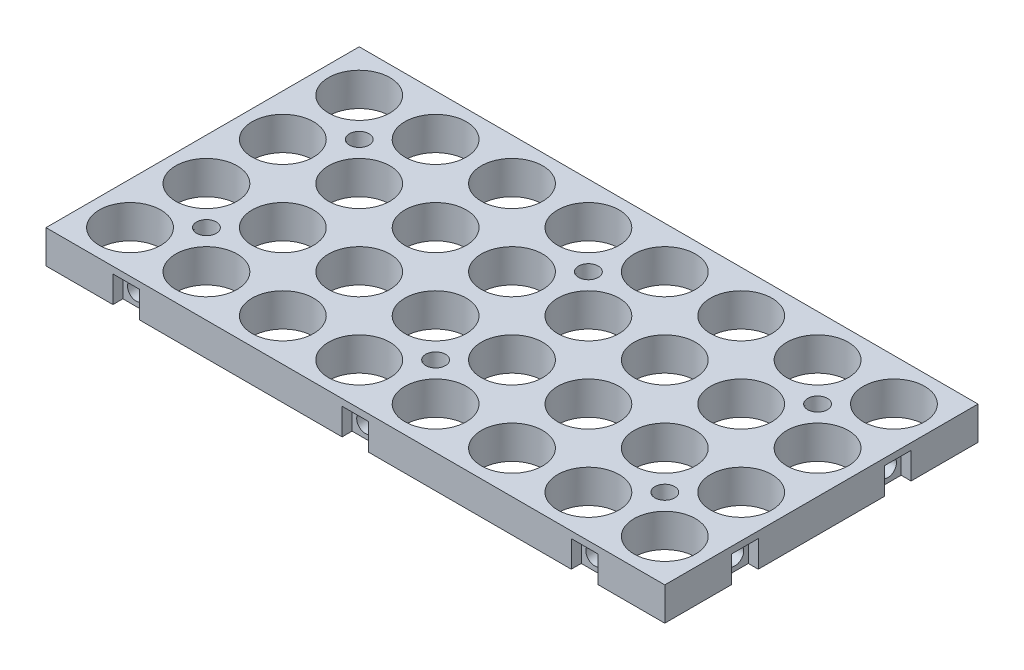
from build123d import *

# Parameters (mm, degrees)
SKETCH1_W                 = 255.3
SKETCH1_H                 = 94.3
BOSS_EXTRUDE1_DEPTH       = 10
SKETCH2_R                 = 9.25
CUT_EXTRUDE1_DEPTH        = 22.3
LPATTERN1_COUNT           = 4
LPATTERN1_PITCH           = 23
LPATTERN1_COUNT_DIR2      = 8
LPATTERN1_PITCH_DIR2      = 23
ADVANCEDHOLE1_OUTLINE_R   = 2.640000288
ADVANCEDHOLE1_DEPTH       = 7.996
ADVANCEDHOLE1_DRAFT       = -2.36329
ADVANCEDHOLE1_2_OUTLINE_R = 2.640000288
ADVANCEDHOLE1_2_DEPTH     = 7.996
ADVANCEDHOLE1_2_DRAFT     = -2.36329
ADVANCEDHOLE1_3_OUTLINE_R = 2.640000288
ADVANCEDHOLE1_3_DEPTH     = 7.996
ADVANCEDHOLE1_3_DRAFT     = -2.36329
ADVANCEDHOLE1_4_OUTLINE_R = 2.640000288
ADVANCEDHOLE1_4_DEPTH     = 7.996
ADVANCEDHOLE1_4_DRAFT     = -2.36329
MIRROR1_COPY_1_SKETCH_R   = 2.640000288
MIRROR1_COPY_1_DEPTH      = 7.996
MIRROR1_COPY_1_DRAFT      = -2.36329
MIRROR1_COPY_2_SKETCH_R   = 2.640000288
MIRROR1_COPY_2_DEPTH      = 7.996
MIRROR1_COPY_2_DRAFT      = -2.36329
MIRROR1_COPY_3_SKETCH_R   = 2.640000288
MIRROR1_COPY_3_DEPTH      = 7.996
MIRROR1_COPY_3_DRAFT      = -2.36329
MIRROR1_COPY_4_SKETCH_R   = 2.640000288
MIRROR1_COPY_4_DEPTH      = 7.996
MIRROR1_COPY_4_DRAFT      = -2.36329
MIRROR1_COPY_5_SKETCH_R   = 2.640000288
MIRROR1_COPY_5_DEPTH      = 7.996
MIRROR1_COPY_5_DRAFT      = -2.36329
MIRROR1_COPY_6_SKETCH_R   = 2.640000288
MIRROR1_COPY_6_DEPTH      = 7.996
MIRROR1_COPY_6_DRAFT      = -2.36329
MIRROR1_COPY_7_SKETCH_R   = 2.640000288
MIRROR1_COPY_7_DEPTH      = 7.996
MIRROR1_COPY_7_DRAFT      = -2.36329
SKETCH6_W                 = 69
SKETCH6_H                 = 94.3
CUT_EXTRUDE2_DEPTH        = 273.342761975
SKETCH8_W                 = 8
SKETCH8_H                 = 8
CUT_EXTRUDE3_DEPTH        = 3
LPATTERN2_COUNT           = 3
LPATTERN2_PITCH           = 69
MIRROR2_COPY_1_SKETCH_W   = 8
MIRROR2_COPY_1_SKETCH_H   = 8
MIRROR2_COPY_1_DEPTH      = 3
MIRROR2_COPY_2_SKETCH_W   = 8
MIRROR2_COPY_2_SKETCH_H   = 8
MIRROR2_COPY_2_DEPTH      = 3
SKETCH9_W                 = 8
SKETCH9_H                 = 8
CUT_EXTRUDE4_DEPTH        = 3
LPATTERN3_COUNT           = 2
LPATTERN3_PITCH           = 46
MIRROR3_COPY_1_SKETCH_W   = 8
MIRROR3_COPY_1_SKETCH_H   = 8
MIRROR3_COPY_1_DEPTH      = 3


# Read off the part's stored shape, not the designer's step: AdvancedHole1, AdvancedHole2, AdvancedHole3
with BuildPart() as part:
    # Sketch1 → Boss-Extrude1 (new body)
    with BuildSketch(Plane(origin=(0, 0, 0), x_dir=(1, 0, 0), z_dir=(0, 1, 0))):
        with Locations((127.65, 47.15)):
            Rectangle(SKETCH1_W, SKETCH1_H)
    extrude(amount=BOSS_EXTRUDE1_DEPTH)

    # Sketch2 → Cut-Extrude1 (cut)
    with BuildSketch(Plane(origin=(0, 10, 0), x_dir=(1, 0, 0), z_dir=(0, 1, 0))):
        with Locations(Location((12.65, 12.65, 0), (0, 0, 270))):
            Circle(SKETCH2_R)
    cut_extrude1 = extrude(amount=-CUT_EXTRUDE1_DEPTH, mode=Mode.SUBTRACT)

    # LPattern1: Cut-Extrude1 4 × 8
    with Locations(*[(j * LPATTERN1_PITCH_DIR2, 0, -i * LPATTERN1_PITCH) for i in range(LPATTERN1_COUNT) for j in range(LPATTERN1_COUNT_DIR2) if (i, j) != (0, 0)]):
        add(cut_extrude1, mode=Mode.SUBTRACT)


with BuildPart() as advancedhole1_tool:
    # AdvancedHole1 outline → AdvancedHole1 (with draft: the straight prism first)
    with BuildSketch(Plane(origin=(0, 2.004, 0), x_dir=(1, 0, 0), z_dir=(0, 1, 0))):
        with Locations((162.15, 70.15)):
            Circle(ADVANCEDHOLE1_OUTLINE_R)
    extrude(amount=ADVANCEDHOLE1_DEPTH)
    # AdvancedHole1: the draft: its side faces are tilted about the plane it starts from
    advancedhole1_sides = [advancedhole1_tool.faces().sort_by_distance(p)[0] for p in [
        (159.509999712, 6.002, -70.15),
    ]]
    draft(advancedhole1_sides, Plane(origin=(0, 2.004, 0), x_dir=(1, 0, 0), z_dir=(0, 1, 0)), ADVANCEDHOLE1_DRAFT)


with BuildPart() as part_1:
    add(part.part)

    # AdvancedHole1: cut by advancedhole1_tool
    add(advancedhole1_tool.part, mode=Mode.SUBTRACT)


with BuildPart() as advancedhole1_2_tool:
    # AdvancedHole1 2 outline → AdvancedHole1 2 (with draft: the straight prism first)
    with BuildSketch(Plane(origin=(0, 2.004, 0), x_dir=(1, 0, 0), z_dir=(0, 1, 0))):
        with Locations((93.15, 70.15)):
            Circle(ADVANCEDHOLE1_2_OUTLINE_R)
    extrude(amount=ADVANCEDHOLE1_2_DEPTH)
    # AdvancedHole1 2: the draft: its side faces are tilted about the plane it starts from
    advancedhole1_2_sides = [advancedhole1_2_tool.faces().sort_by_distance(p)[0] for p in [
        (90.509999712, 6.002, -70.15),
    ]]
    draft(advancedhole1_2_sides, Plane(origin=(0, 2.004, 0), x_dir=(1, 0, 0), z_dir=(0, 1, 0)), ADVANCEDHOLE1_2_DRAFT)


with BuildPart() as part_2:
    add(part_1.part)

    # AdvancedHole1 2: cut by advancedhole1_2_tool
    add(advancedhole1_2_tool.part, mode=Mode.SUBTRACT)


with BuildPart() as advancedhole1_3_tool:
    # AdvancedHole1 3 outline → AdvancedHole1 3 (with draft: the straight prism first)
    with BuildSketch(Plane(origin=(0, 2.004, 0), x_dir=(1, 0, 0), z_dir=(0, 1, 0))):
        with Locations((24.15, 70.15)):
            Circle(ADVANCEDHOLE1_3_OUTLINE_R)
    extrude(amount=ADVANCEDHOLE1_3_DEPTH)
    # AdvancedHole1 3: the draft: its side faces are tilted about the plane it starts from
    advancedhole1_3_sides = [advancedhole1_3_tool.faces().sort_by_distance(p)[0] for p in [
        (21.509999712, 6.002, -70.15),
    ]]
    draft(advancedhole1_3_sides, Plane(origin=(0, 2.004, 0), x_dir=(1, 0, 0), z_dir=(0, 1, 0)), ADVANCEDHOLE1_3_DRAFT)


with BuildPart() as part_3:
    add(part_2.part)

    # AdvancedHole1 3: cut by advancedhole1_3_tool
    add(advancedhole1_3_tool.part, mode=Mode.SUBTRACT)


with BuildPart() as advancedhole1_4_tool:
    # AdvancedHole1 4 outline → AdvancedHole1 4 (with draft: the straight prism first)
    with BuildSketch(Plane(origin=(0, 2.004, 0), x_dir=(1, 0, 0), z_dir=(0, 1, 0))):
        with Locations((231.15, 70.15)):
            Circle(ADVANCEDHOLE1_4_OUTLINE_R)
    extrude(amount=ADVANCEDHOLE1_4_DEPTH)
    # AdvancedHole1 4: the draft: its side faces are tilted about the plane it starts from
    advancedhole1_4_sides = [advancedhole1_4_tool.faces().sort_by_distance(p)[0] for p in [
        (228.509999712, 6.002, -70.15),
    ]]
    draft(advancedhole1_4_sides, Plane(origin=(0, 2.004, 0), x_dir=(1, 0, 0), z_dir=(0, 1, 0)), ADVANCEDHOLE1_4_DRAFT)


with BuildPart() as part_4:
    add(part_3.part)

    # AdvancedHole1 4: cut by advancedhole1_4_tool
    add(advancedhole1_4_tool.part, mode=Mode.SUBTRACT)


with BuildPart() as mirror1_copy_1_tool:
    # Mirror1 copy 1 sketch → Mirror1 copy 1 (with draft: the straight prism first)
    with BuildSketch(Plane(origin=(0, 2.004, -94.3), x_dir=(1, 0, 0), z_dir=(0, 1, 0))):
        with Locations((162.15, -70.15)):
            Circle(MIRROR1_COPY_1_SKETCH_R)
    extrude(amount=MIRROR1_COPY_1_DEPTH)
    # Mirror1 copy 1: the draft: its side faces are tilted about the plane it starts from
    mirror1_copy_1_sides = [mirror1_copy_1_tool.faces().sort_by_distance(p)[0] for p in [
        (159.509999712, 6.002, -24.15),
    ]]
    draft(mirror1_copy_1_sides, Plane(origin=(0, 2.004, -94.3), x_dir=(1, 0, 0), z_dir=(0, 1, 0)), MIRROR1_COPY_1_DRAFT)


with BuildPart() as part_5:
    add(part_4.part)

    # Mirror1 copy 1: cut by mirror1_copy_1_tool
    add(mirror1_copy_1_tool.part, mode=Mode.SUBTRACT)


with BuildPart() as mirror1_copy_2_tool:
    # Mirror1 copy 2 sketch → Mirror1 copy 2 (with draft: the straight prism first)
    with BuildSketch(Plane(origin=(0, 2.004, -94.3), x_dir=(1, 0, 0), z_dir=(0, 1, 0))):
        with Locations((93.15, -70.15)):
            Circle(MIRROR1_COPY_2_SKETCH_R)
    extrude(amount=MIRROR1_COPY_2_DEPTH)
    # Mirror1 copy 2: the draft: its side faces are tilted about the plane it starts from
    mirror1_copy_2_sides = [mirror1_copy_2_tool.faces().sort_by_distance(p)[0] for p in [
        (90.509999712, 6.002, -24.15),
    ]]
    draft(mirror1_copy_2_sides, Plane(origin=(0, 2.004, -94.3), x_dir=(1, 0, 0), z_dir=(0, 1, 0)), MIRROR1_COPY_2_DRAFT)


with BuildPart() as part_6:
    add(part_5.part)

    # Mirror1 copy 2: cut by mirror1_copy_2_tool
    add(mirror1_copy_2_tool.part, mode=Mode.SUBTRACT)


with BuildPart() as mirror1_copy_3_tool:
    # Mirror1 copy 3 sketch → Mirror1 copy 3 (with draft: the straight prism first)
    with BuildSketch(Plane(origin=(0, 2.004, -94.3), x_dir=(1, 0, 0), z_dir=(0, 1, 0))):
        with Locations((24.15, -70.15)):
            Circle(MIRROR1_COPY_3_SKETCH_R)
    extrude(amount=MIRROR1_COPY_3_DEPTH)
    # Mirror1 copy 3: the draft: its side faces are tilted about the plane it starts from
    mirror1_copy_3_sides = [mirror1_copy_3_tool.faces().sort_by_distance(p)[0] for p in [
        (21.509999712, 6.002, -24.15),
    ]]
    draft(mirror1_copy_3_sides, Plane(origin=(0, 2.004, -94.3), x_dir=(1, 0, 0), z_dir=(0, 1, 0)), MIRROR1_COPY_3_DRAFT)


with BuildPart() as part_7:
    add(part_6.part)

    # Mirror1 copy 3: cut by mirror1_copy_3_tool
    add(mirror1_copy_3_tool.part, mode=Mode.SUBTRACT)


with BuildPart() as mirror1_copy_4_tool:
    # Mirror1 copy 4 sketch → Mirror1 copy 4 (with draft: the straight prism first)
    with BuildSketch(Plane(origin=(0, 2.004, -94.3), x_dir=(1, 0, 0), z_dir=(0, 1, 0))):
        with Locations((231.15, -70.15)):
            Circle(MIRROR1_COPY_4_SKETCH_R)
    extrude(amount=MIRROR1_COPY_4_DEPTH)
    # Mirror1 copy 4: the draft: its side faces are tilted about the plane it starts from
    mirror1_copy_4_sides = [mirror1_copy_4_tool.faces().sort_by_distance(p)[0] for p in [
        (228.509999712, 6.002, -24.15),
    ]]
    draft(mirror1_copy_4_sides, Plane(origin=(0, 2.004, -94.3), x_dir=(1, 0, 0), z_dir=(0, 1, 0)), MIRROR1_COPY_4_DRAFT)


with BuildPart() as part_8:
    add(part_7.part)

    # Mirror1 copy 4: cut by mirror1_copy_4_tool
    add(mirror1_copy_4_tool.part, mode=Mode.SUBTRACT)


with BuildPart() as mirror1_copy_5_tool:
    # Mirror1 copy 5 sketch → Mirror1 copy 5 (with draft: the straight prism first)
    with BuildSketch(Plane(origin=(0, 2.004, -94.3), x_dir=(1, 0, 0), z_dir=(0, 1, 0))):
        with Locations((93.15, -70.15)):
            Circle(MIRROR1_COPY_5_SKETCH_R)
    extrude(amount=MIRROR1_COPY_5_DEPTH)
    # Mirror1 copy 5: the draft: its side faces are tilted about the plane it starts from
    mirror1_copy_5_sides = [mirror1_copy_5_tool.faces().sort_by_distance(p)[0] for p in [
        (90.509999712, 6.002, -24.15),
    ]]
    draft(mirror1_copy_5_sides, Plane(origin=(0, 2.004, -94.3), x_dir=(1, 0, 0), z_dir=(0, 1, 0)), MIRROR1_COPY_5_DRAFT)


with BuildPart() as part_9:
    add(part_8.part)

    # Mirror1 copy 5: cut by mirror1_copy_5_tool
    add(mirror1_copy_5_tool.part, mode=Mode.SUBTRACT)


with BuildPart() as mirror1_copy_6_tool:
    # Mirror1 copy 6 sketch → Mirror1 copy 6 (with draft: the straight prism first)
    with BuildSketch(Plane(origin=(0, 2.004, -94.3), x_dir=(1, 0, 0), z_dir=(0, 1, 0))):
        with Locations((24.15, -70.15)):
            Circle(MIRROR1_COPY_6_SKETCH_R)
    extrude(amount=MIRROR1_COPY_6_DEPTH)
    # Mirror1 copy 6: the draft: its side faces are tilted about the plane it starts from
    mirror1_copy_6_sides = [mirror1_copy_6_tool.faces().sort_by_distance(p)[0] for p in [
        (21.509999712, 6.002, -24.15),
    ]]
    draft(mirror1_copy_6_sides, Plane(origin=(0, 2.004, -94.3), x_dir=(1, 0, 0), z_dir=(0, 1, 0)), MIRROR1_COPY_6_DRAFT)


with BuildPart() as part_10:
    add(part_9.part)

    # Mirror1 copy 6: cut by mirror1_copy_6_tool
    add(mirror1_copy_6_tool.part, mode=Mode.SUBTRACT)


with BuildPart() as mirror1_copy_7_tool:
    # Mirror1 copy 7 sketch → Mirror1 copy 7 (with draft: the straight prism first)
    with BuildSketch(Plane(origin=(0, 2.004, -94.3), x_dir=(1, 0, 0), z_dir=(0, 1, 0))):
        with Locations((231.15, -70.15)):
            Circle(MIRROR1_COPY_7_SKETCH_R)
    extrude(amount=MIRROR1_COPY_7_DEPTH)
    # Mirror1 copy 7: the draft: its side faces are tilted about the plane it starts from
    mirror1_copy_7_sides = [mirror1_copy_7_tool.faces().sort_by_distance(p)[0] for p in [
        (228.509999712, 6.002, -24.15),
    ]]
    draft(mirror1_copy_7_sides, Plane(origin=(0, 2.004, -94.3), x_dir=(1, 0, 0), z_dir=(0, 1, 0)), MIRROR1_COPY_7_DRAFT)


with BuildPart() as part_11:
    add(part_10.part)

    # Mirror1 copy 7: cut by mirror1_copy_7_tool
    add(mirror1_copy_7_tool.part, mode=Mode.SUBTRACT)

    # Sketch6 → Cut-Extrude2 (cut, through all)
    with BuildSketch(Plane(origin=(0, 10, 0), x_dir=(1, 0, 0), z_dir=(0, 1, 0))):
        with Locations((220.8, 47.15)):
            Rectangle(SKETCH6_W, SKETCH6_H)
    extrude(amount=-CUT_EXTRUDE2_DEPTH, mode=Mode.SUBTRACT)

    # Sketch8 → Cut-Extrude3 (cut)
    with BuildSketch(Plane.XY):
        with Locations((24.15, 4)):
            Rectangle(SKETCH8_W, SKETCH8_H)
    cut_extrude3 = extrude(amount=-CUT_EXTRUDE3_DEPTH, mode=Mode.SUBTRACT)

    # AdvancedHole2 outline → AdvancedHole2 (revolve, cut)
    with BuildSketch(Plane(origin=(24.15, 4, 0), x_dir=(1, 0, 0), z_dir=(0, -1, 0))):
        Polygon((0, -6.89), (2.524951623, -6.89), (2.615, -3), (0, -3), align=None)
    advancedhole2 = revolve(axis=Axis((24.15, 4, 0), (0, 0, 1)), mode=Mode.SUBTRACT)

    # LPattern2: Cut-Extrude3, AdvancedHole2 ×3
    with Locations(*[(i * LPATTERN2_PITCH, 0, 0) for i in range(1, LPATTERN2_COUNT)]):
        add(cut_extrude3, mode=Mode.SUBTRACT)
        add(advancedhole2, mode=Mode.SUBTRACT)

    # Mirror2: Cut-Extrude3, AdvancedHole2 across plane
    add(cut_extrude3.mirror(Plane.XY.offset(-47.15)), mode=Mode.SUBTRACT)
    add(advancedhole2.mirror(Plane.XY.offset(-47.15)), mode=Mode.SUBTRACT)

    # Mirror2 copy 1 sketch → Mirror2 copy 1 (cut)
    with BuildSketch(Plane(origin=(69, 0, -94.3), x_dir=(1, 0, 0), z_dir=(0, 0, -1))):
        with Locations((24.15, -4)):
            Rectangle(MIRROR2_COPY_1_SKETCH_W, MIRROR2_COPY_1_SKETCH_H)
    extrude(amount=-MIRROR2_COPY_1_DEPTH, mode=Mode.SUBTRACT)

    # Mirror2 copy 2 sketch → Mirror2 copy 2 (cut)
    with BuildSketch(Plane(origin=(138, 0, -94.3), x_dir=(1, 0, 0), z_dir=(0, 0, -1))):
        with Locations((24.15, -4)):
            Rectangle(MIRROR2_COPY_2_SKETCH_W, MIRROR2_COPY_2_SKETCH_H)
    extrude(amount=-MIRROR2_COPY_2_DEPTH, mode=Mode.SUBTRACT)

    # Mirror2 copy 3 sketch → Mirror2 copy 3 (revolve, cut)
    with BuildSketch(Plane(origin=(93.15, 4, -94.3), x_dir=(1, 0, 0), z_dir=(0, -1, 0))):
        Polygon((0, 6.89), (2.524951623, 6.89), (2.615, 3), (0, 3), align=None)
    revolve(axis=Axis((93.15, 4, -94.3), (0, 0, 1)), mode=Mode.SUBTRACT)

    # Mirror2 copy 4 sketch → Mirror2 copy 4 (revolve, cut)
    with BuildSketch(Plane(origin=(162.15, 4, -94.3), x_dir=(1, 0, 0), z_dir=(0, -1, 0))):
        Polygon((0, 6.89), (2.524951623, 6.89), (2.615, 3), (0, 3), align=None)
    revolve(axis=Axis((162.15, 4, -94.3), (0, 0, 1)), mode=Mode.SUBTRACT)

    # Sketch9 → Cut-Extrude4 (cut)
    with BuildSketch(Plane.ZY):
        with Locations((-70.15, 4)):
            Rectangle(SKETCH9_W, SKETCH9_H)
    cut_extrude4 = extrude(amount=-CUT_EXTRUDE4_DEPTH, mode=Mode.SUBTRACT)

    # AdvancedHole3 outline → AdvancedHole3 (revolve, cut)
    with BuildSketch(Plane(origin=(0, 4, -70.15), x_dir=(0, 1, 0), z_dir=(0, 0, -1))):
        Polygon((2.615, 3), (2.524951623, 6.89), (0, 6.89), (0, 3), align=None)
    advancedhole3 = revolve(axis=Axis((0, 4, -70.15), (1, 0, 0)), mode=Mode.SUBTRACT)

    # LPattern3: Cut-Extrude4, AdvancedHole3 ×2
    with Locations(*[(0, 0, i * LPATTERN3_PITCH) for i in range(1, LPATTERN3_COUNT)]):
        add(cut_extrude4, mode=Mode.SUBTRACT)
        add(advancedhole3, mode=Mode.SUBTRACT)

    # Mirror3: Cut-Extrude4, AdvancedHole3 across plane
    add(cut_extrude4.mirror(Plane(origin=(93.15, 0, 0), x_dir=(0, 0, 1), z_dir=(1, 0, 0))), mode=Mode.SUBTRACT)
    add(advancedhole3.mirror(Plane(origin=(93.15, 0, 0), x_dir=(0, 0, 1), z_dir=(1, 0, 0))), mode=Mode.SUBTRACT)

    # Mirror3 copy 1 sketch → Mirror3 copy 1 (cut)
    with BuildSketch(Plane(origin=(186.3, 0, 46), x_dir=(0, 0, 1), z_dir=(1, 0, 0))):
        with Locations((-70.15, -4)):
            Rectangle(MIRROR3_COPY_1_SKETCH_W, MIRROR3_COPY_1_SKETCH_H)
    extrude(amount=-MIRROR3_COPY_1_DEPTH, mode=Mode.SUBTRACT)

    # Mirror3 copy 2 sketch → Mirror3 copy 2 (revolve, cut)
    with BuildSketch(Plane(origin=(186.3, 4, -24.15), x_dir=(0, 1, 0), z_dir=(0, 0, -1))):
        Polygon((2.615, -3), (2.524951623, -6.89), (0, -6.89), (0, -3), align=None)
    revolve(axis=Axis((186.3, 4, -24.15), (1, 0, 0)), mode=Mode.SUBTRACT)


solid = part_11.part
